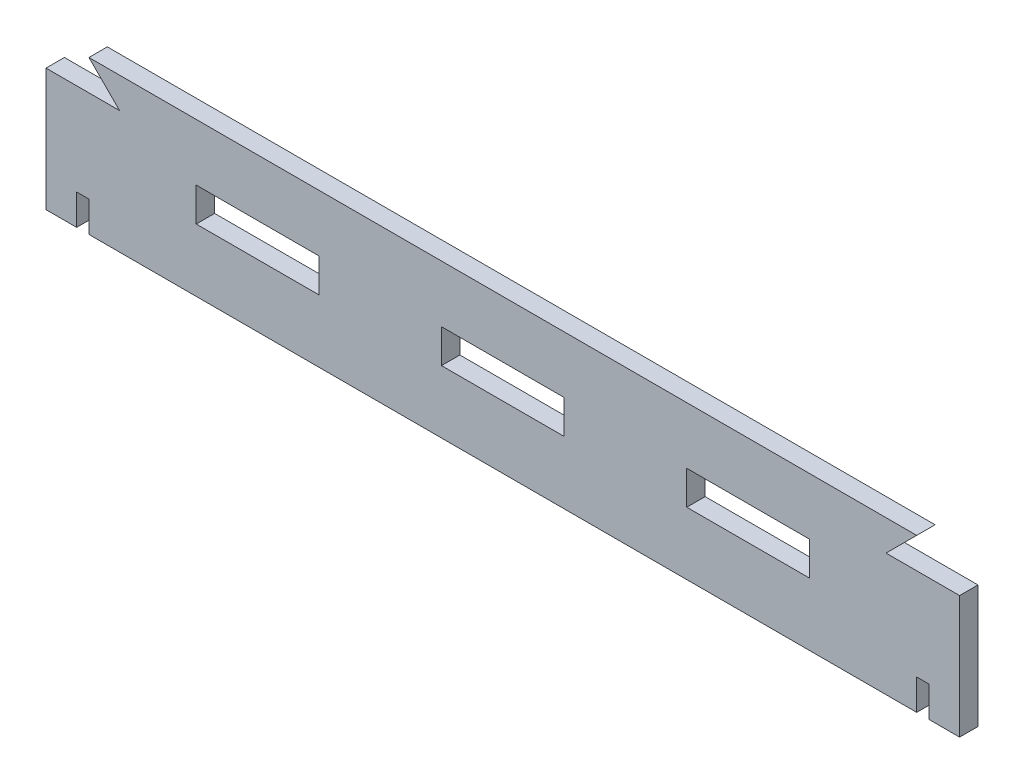
from build123d import *

# Parameters (mm, degrees)
EXTRUDE_1_DEPTH         = 3
CUT_EXTRUDE_START       = -3
CUT_EXTRUDE_1_OUTLINE_W = 20
CUT_EXTRUDE_1_OUTLINE_H = 5.5
CUT_EXTRUDE_1_DEPTH     = 3
CUT_EXTRUDE_1_2_DEPTH   = 3


# Read off the part's stored shape, not the designer's step: 切除-拉伸1
with BuildPart() as part:
    # 草图1 → 凸台-拉伸1 (new body)
    with BuildSketch(Plane.XY):
        Polygon((-78.5, 25), (-68.5, 25), (-73.5, 30), (61.5, 30), (56.5, 25), (66.5, 25), (66.5, 10), (61.5, 10), (61.5, 5), (-73.5, 5), (-73.5, 10), (-78.5, 10), align=None)
    extrude(amount=EXTRUDE_1_DEPTH)

    # 切除-拉伸1 outline → 切除-拉伸1 (cut)
    with BuildSketch(Plane.XY.offset(3).offset(CUT_EXTRUDE_START)):
        with Locations((-6, 17.975640355)):
            Rectangle(CUT_EXTRUDE_1_OUTLINE_W, CUT_EXTRUDE_1_OUTLINE_H)
        with Locations((-46, 17.975640355)):
            Rectangle(CUT_EXTRUDE_1_OUTLINE_W, CUT_EXTRUDE_1_OUTLINE_H)
        with Locations((34, 17.975640355)):
            Rectangle(CUT_EXTRUDE_1_OUTLINE_W, CUT_EXTRUDE_1_OUTLINE_H)
    extrude(amount=CUT_EXTRUDE_1_DEPTH, mode=Mode.SUBTRACT)

    # Cut-Extrude 1 2 outline → Cut-Extrude 1 2 (add)
    with BuildSketch(Plane.XY.offset(3).offset(CUT_EXTRUDE_START)):
        Polygon((-78.5, 25), (-80.5, 25), (-80.5, 5), (-75.5, 5), (-75.5, 10), (-78.5, 10), align=None)
        Polygon((68.5, 25), (66.5, 25), (66.5, 10), (63.5, 10), (63.5, 5), (68.5, 5), align=None)
    extrude(amount=CUT_EXTRUDE_1_2_DEPTH)


solid = part.part
